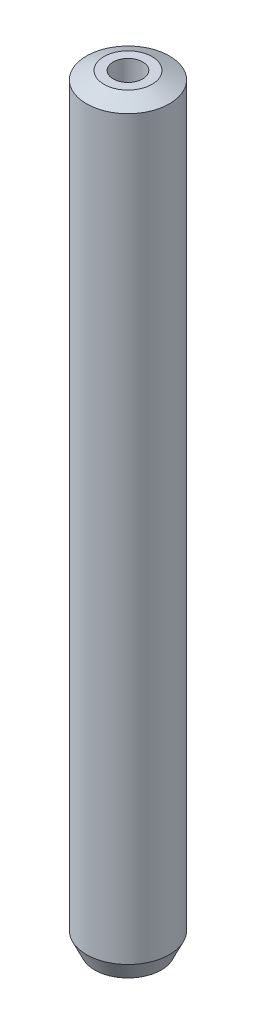
from build123d import *
from OCP.BRepFilletAPI import BRepFilletAPI_MakeChamfer

# Parameters (mm, degrees)
SKETCH1_R           = 7.5
BOSS_EXTRUDE1_DEPTH = 137.877778649
SKETCH2_R           = 2.667252555
CUT_EXTRUDE1_DEPTH  = 139.285146871
CHAMFER1_SIZE       = 1.473795688
CHAMFER1_SIZE2      = 3.152836993


with BuildPart() as part:
    # Sketch1 → Boss-Extrude1 (new body)
    with BuildSketch(Plane(origin=(0, 0, 0), x_dir=(1, 0, 0), z_dir=(0, 1, 0))):
        Circle(SKETCH1_R)
    extrude(amount=BOSS_EXTRUDE1_DEPTH)

    # Sketch2 → Cut-Extrude1 (cut, through all)
    with BuildSketch(Plane(origin=(0, 0, 0), x_dir=(1, 0, 0), z_dir=(0, 1, 0))):
        Circle(SKETCH2_R)
    extrude(amount=CUT_EXTRUDE1_DEPTH, mode=Mode.SUBTRACT)

    # Chamfer1: one chamfer whose edges measure the first distance from different faces: ONE call of the kernel's chamfer builder (chamfer() names one face for all edges)
    chamfer1_edges_1 = [part.edges().sort_by_distance(p)[0] for p in [
        (-7.5, 137.877778649, 0),
    ]]
    chamfer1_side_1 = [part.faces().sort_by_distance(p)[0] for p in [
        (-7.5, 68.938889325, 0),
    ]]
    chamfer1_edges_2 = [part.edges().sort_by_distance(p)[0] for p in [
        (-7.5, 0, 0),
    ]]
    chamfer1_side_2 = [part.faces().sort_by_distance(p)[0] for p in [
        (-7.287867966, 0, 0),
    ]]
    chamfer1 = BRepFilletAPI_MakeChamfer(part.part.solid().wrapped)
    for e in chamfer1_edges_1:
        chamfer1.Add(CHAMFER1_SIZE, CHAMFER1_SIZE2, e.wrapped, chamfer1_side_1[0].wrapped)  # the first distance lies on this face
    for e in chamfer1_edges_2:
        chamfer1.Add(CHAMFER1_SIZE, CHAMFER1_SIZE2, e.wrapped, chamfer1_side_2[0].wrapped)  # the first distance lies on this face
    add(Compound.cast(chamfer1.Shape()), mode=Mode.REPLACE)


solid = part.part
